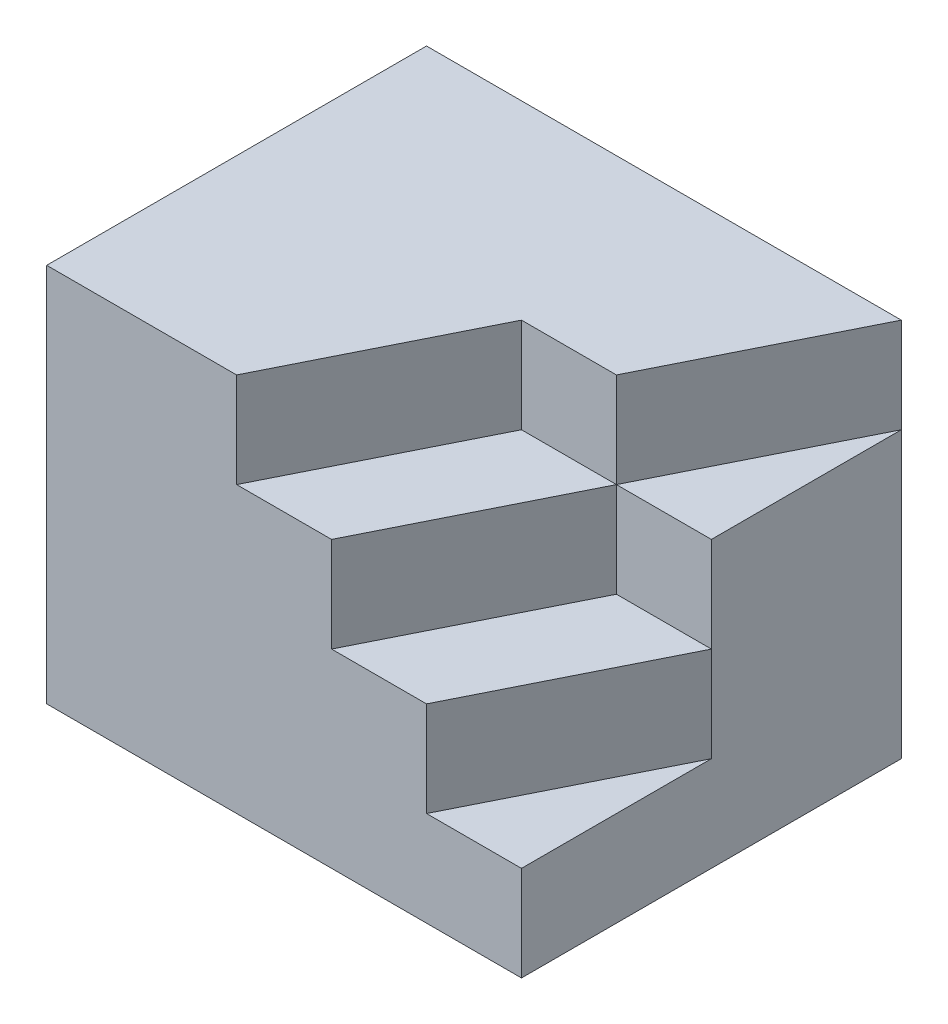
from build123d import *

# Parameters (mm, degrees)
SKETCH_1_W           = 25
SKETCH_1_H           = 20
EXTRUDE_1_DEPTH      = 20
CUT_EXTRUDE_1_DEPTH  = 5
CUT_EXTRUDE_8_DEPTH  = 5
CUT_EXTRUDE_11_DEPTH = 5
CUT_EXTRUDE_12_DEPTH = 5


with BuildPart() as part:
    # 草圖1 → 填料-伸長1 (new body)
    with BuildSketch(Plane.XY):
        with Locations((12.5, 10)):
            Rectangle(SKETCH_1_W, SKETCH_1_H)
    extrude(amount=-EXTRUDE_1_DEPTH)

    # 草圖2 → 除料-伸長1 (cut)
    with BuildSketch(Plane(origin=(0, 20, 0), x_dir=(1, 0, 0), z_dir=(0, 1, 0))):
        Polygon((10, 0), (15, 10), (20, 10), (15, 0), align=None)
    extrude(amount=-CUT_EXTRUDE_1_DEPTH, mode=Mode.SUBTRACT)

    # 草圖4 → 除料-伸長8 (cut)
    with BuildSketch(Plane(origin=(0, 20, 0), x_dir=(1, 0, 0), z_dir=(0, 1, 0))):
        Polygon((25, 0), (25, 20), (15, 0), align=None)
    extrude(amount=-CUT_EXTRUDE_8_DEPTH, mode=Mode.SUBTRACT)

    # 草圖6 → 除料-伸長11 (cut)
    with BuildSketch(Plane(origin=(0, 15, 0), x_dir=(1, 0, 0), z_dir=(0, 1, 0))):
        Polygon((15, 0), (20, 10), (25, 10), (25, 0), align=None)
    extrude(amount=-CUT_EXTRUDE_11_DEPTH, mode=Mode.SUBTRACT)

    # 草圖8 → 除料-伸長12 (cut)
    with BuildSketch(Plane(origin=(0, 10, 0), x_dir=(1, 0, 0), z_dir=(0, 1, 0))):
        Polygon((25, 10), (25, 0), (20, 0), align=None)
    extrude(amount=-CUT_EXTRUDE_12_DEPTH, mode=Mode.SUBTRACT)


solid = part.part
